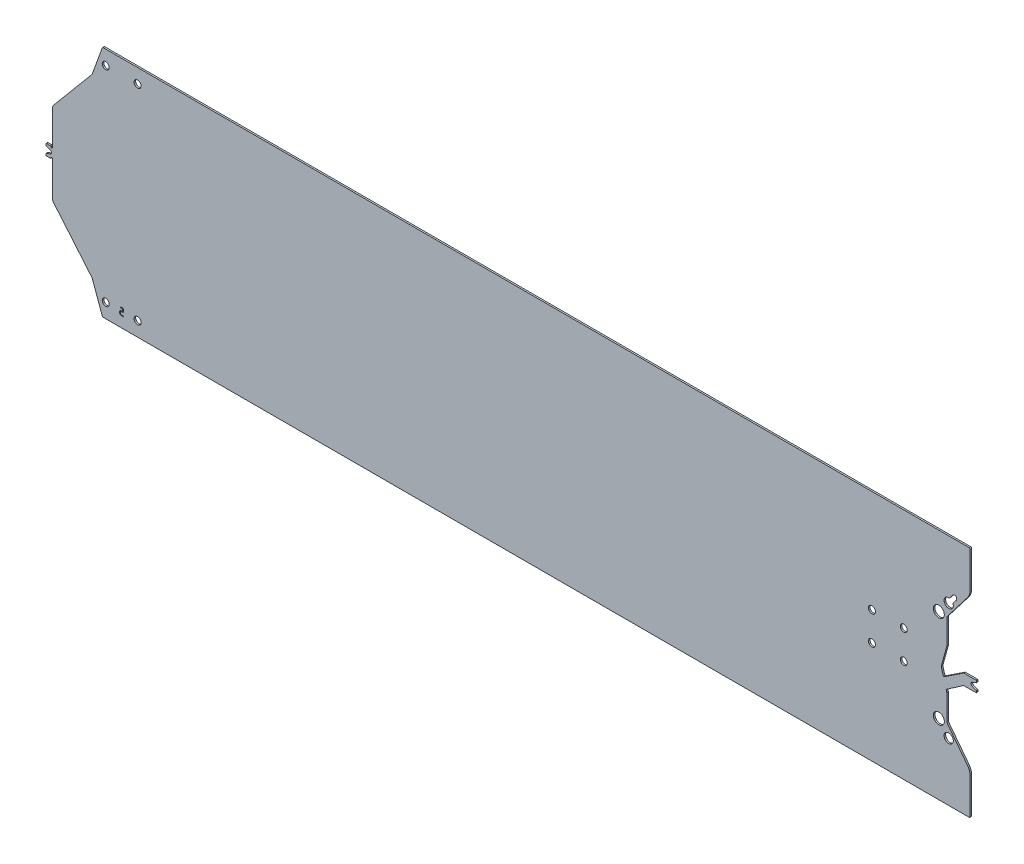
from build123d import *

# Parameters (mm, degrees)
SKETCH1_R                      = 17.25
SKETCH1_R_2                    = 11
SKETCH1_R_3                    = 14.5
BASE_EXTRUDE_DEPTH             = 5
F_5_TAL_DEPTH                  = 2924.07154377
SKETCH2_OUTSIDE_W              = 3524.12
SKETCH2_OUTSIDE_H              = 1337.12
BORTSK_RING_AF_BUKKESTOP_DEPTH = 5
FARINA_BUKKESTOPS_DEPTH        = 5


with BuildPart() as part:
    # Sketch1 → Base-Extrude (new body)
    with BuildSketch(Plane.XY):
        with BuildLine():
            Line((0, 363.5), (0, 252.078170355))
            ThreePointArc((0, 252.078170355), (-2.12279482, 239.220591742), (-8.265866388, 227.727713194))
            Line((-8.265866388, 227.727713194), (-70.933533403, 146.057619484))
            ThreePointArc((-70.933533403, 146.057619484), (-72.469301295, 143.184399847), (-73, 139.970005194))
            Line((-73, 139.970005194), (-73, 63))
            Line((-73, 63), (-89.730328668, 2.672383761))
            ThreePointArc((-89.730328668, 2.672383761), (-90.00268311, 1.348509303), (-90.094024136, 0))
            Line((-90.094024136, 0), (17, 0))
            ThreePointArc((17, 0), (19.121320344, -0.878679656), (20, -3))
            Line((20, -3), (20, -17.437757944))
            ThreePointArc((20, -17.437757944), (19.281217897, -19.386102089), (17.469303395, -20.400822965))
            Line((17.469303395, -20.400822965), (-80.510157999, -35.919245122))
            Line((-80.510157999, -35.919245122), (-73, -63))
            Line((-73, -63), (-73, -139.970005194))
            ThreePointArc((-73, -139.970005194), (-72.469301295, -143.184399847), (-70.933533403, -146.057619484))
            Line((-70.933533403, -146.057619484), (-8.265866388, -227.727713194))
            ThreePointArc((-8.265866388, -227.727713194), (-2.12279482, -239.220591742), (0, -252.078170355))
            Line((0, -252.078170355), (0, -363.5))
            ThreePointArc((0, -363.5), (-0.878679656, -365.621320344), (-3, -366.5))
            Line((-3, -366.5), (-2720.535761072, -366.5))
            ThreePointArc((-2720.535761072, -366.5), (-2722.256490381, -365.957456133), (-2723.354838934, -364.52606043))
            Line((-2723.354838934, -364.52606043), (-2754.790630978, -278.156931626))
            ThreePointArc((-2754.790630978, -278.156931626), (-2755.527303148, -276.577133059), (-2756.527112755, -275.149256963))
            Line((-2756.527112755, -275.149256963), (-2875.320888862, -133.576347508))
            ThreePointArc((-2875.320888862, -133.576347508), (-2878.793852416, -127.560998181), (-2880, -120.720595315))
            Line((-2880, -120.720595315), (-2880, -22.342329219))
            ThreePointArc((-2880, -22.342329219), (-2880.635383686, -20.496092591), (-2882.272393125, -19.431901719))
            Line((-2882.272393125, -19.431901719), (-2897.727606875, -15.568098281))
            ThreePointArc((-2897.727606875, -15.568098281), (-2899.364616314, -14.503907409), (-2900, -12.657670781))
            Line((-2900, -12.657670781), (-2900, -3))
            ThreePointArc((-2900, -3), (-2899.121320344, -0.878679656), (-2897, 0))
            Line((-2897, 0), (-2892.062257748, 0))
            ThreePointArc((-2892.062257748, 0), (-2889.427026365, -0.750817072), (-2887.583225666, -2.777777778))
            ThreePointArc((-2887.583225666, -2.777777778), (-2883.087011135, -4.894412835), (-2880, -1))
            Line((-2880, -1), (-2880, 0))
            Line((-2880, 0), (-2880, 120.720595315))
            ThreePointArc((-2880, 120.720595315), (-2878.793852416, 127.560998181), (-2875.320888862, 133.576347508))
            Line((-2875.320888862, 133.576347508), (-2756.527112755, 275.149256963))
            ThreePointArc((-2756.527112755, 275.149256963), (-2755.527303148, 276.577133059), (-2754.790630978, 278.156931626))
            Line((-2754.790630978, 278.156931626), (-2723.354838934, 364.52606043))
            ThreePointArc((-2723.354838934, 364.52606043), (-2722.256490381, 365.957456133), (-2720.535761072, 366.5))
            Line((-2720.535761072, 366.5), (-3, 366.5))
            ThreePointArc((-3, 366.5), (-0.878679656, 365.621320344), (0, 363.5))
        make_face()
        with Locations((-98, 145.25)):
            Circle(SKETCH1_R, mode=Mode.SUBTRACT)
        with Locations((-2712.5, 321.5)):
            Circle(SKETCH1_R_2, mode=Mode.SUBTRACT)
        with Locations((-2612.5, 321.5)):
            Circle(SKETCH1_R_2, mode=Mode.SUBTRACT)
        with Locations(Location((-2612.5, -321.5, 0), (0, 0, 180))):
            Circle(SKETCH1_R_2, mode=Mode.SUBTRACT)
        with Locations(Location((-2712.5, -321.5, 0), (0, 0, 180))):
            Circle(SKETCH1_R_2, mode=Mode.SUBTRACT)
        with Locations(Location((-98, -145.25, 0), (0, 0, 180))):
            Circle(SKETCH1_R, mode=Mode.SUBTRACT)
        with Locations(Location((-67, -183.75, 0), (0, 0, 180))):
            Circle(SKETCH1_R_3, mode=Mode.SUBTRACT)
        with Locations((-308, 45)):
            Circle(SKETCH1_R_2, mode=Mode.SUBTRACT)
        with Locations((-208, 45)):
            Circle(SKETCH1_R_2, mode=Mode.SUBTRACT)
        with Locations(Location((-308, -45, 0), (0, 0, 180))):
            Circle(SKETCH1_R_2, mode=Mode.SUBTRACT)
        with Locations(Location((-208, -45, 0), (0, 0, 180))):
            Circle(SKETCH1_R_2, mode=Mode.SUBTRACT)
        with BuildLine():
            Line((-43.183683748, 203.289270206), (-52.703856204, 190.882339907))
            ThreePointArc((-52.703856204, 190.882339907), (-53.278899256, 189.573129916), (-53.18257398, 188.146446085))
            ThreePointArc((-53.18257398, 188.146446085), (-75.827040721, 172.246376566), (-66.329572191, 198.234492623))
            ThreePointArc((-66.329572191, 198.234492623), (-64.926570616, 198.510702498), (-63.810802968, 199.404999913))
            Line((-63.810802968, 199.404999913), (-54.290630512, 211.811930212))
            ThreePointArc((-54.290630512, 211.811930212), (-44.475827127, 213.104073591), (-43.183683748, 203.289270206))
        make_face(mode=Mode.SUBTRACT)
    extrude(amount=BASE_EXTRUDE_DEPTH)

    # Sketch5 → 5 tal (cut, through all)
    with BuildSketch(Plane.XY.offset(5)):
        with BuildLine():
            Line((-2665.75, -313), (-2660.25, -313))
            ThreePointArc((-2660.25, -313), (-2659.542893219, -313.292893219), (-2659.25, -314))
            Line((-2659.25, -314), (-2659.25, -319))
            ThreePointArc((-2659.25, -319), (-2659.542893219, -319.707106781), (-2660.25, -320))
            Line((-2660.25, -320), (-2662.5, -320))
            ThreePointArc((-2662.5, -320), (-2669.25, -326.75), (-2662.5, -333.5))
            Line((-2662.5, -333.5), (-2657.75, -333.5))
            ThreePointArc((-2657.75, -333.5), (-2657.042893219, -333.207106781), (-2656.75, -332.5))
            Line((-2656.75, -332.5), (-2656.75, -332))
            ThreePointArc((-2656.75, -332), (-2657.042893219, -331.292893219), (-2657.75, -331))
            Line((-2657.75, -331), (-2662.5, -331))
            ThreePointArc((-2662.5, -331), (-2666.75, -326.75), (-2662.5, -322.5))
            Line((-2662.5, -322.5), (-2660.25, -322.5))
            ThreePointArc((-2660.25, -322.5), (-2657.775126266, -321.474873734), (-2656.75, -319))
            Line((-2656.75, -319), (-2656.75, -314))
            ThreePointArc((-2656.75, -314), (-2657.775126266, -311.525126266), (-2660.25, -310.5))
            Line((-2660.25, -310.5), (-2665.75, -310.5))
            ThreePointArc((-2665.75, -310.5), (-2666.457106781, -310.792893219), (-2666.75, -311.5))
            Line((-2666.75, -311.5), (-2666.75, -312))
            ThreePointArc((-2666.75, -312), (-2666.457106781, -312.707106781), (-2665.75, -313))
        make_face()
    extrude(amount=-F_5_TAL_DEPTH, mode=Mode.SUBTRACT)

    # Sketch2 outside → Bortskæring af bukkestop (cut)
    with BuildSketch(Plane.XY.offset(5)):
        with Locations((-1440, 0)):
            Rectangle(SKETCH2_OUTSIDE_W, SKETCH2_OUTSIDE_H)
        with BuildLine():
            Line((0, -524.643652554), (-2880, -524.643652554))
            Line((-2880, -524.643652554), (-2880, 479.359658705))
            Line((-2880, 479.359658705), (0, 479.359658705))
            Line((0, 479.359658705), (0, 139.970005194))
            Line((0, 139.970005194), (-73, 139.970005194))
            Line((-73, 139.970005194), (-73, 63))
            Line((-73, 63), (-89.730328668, 2.672383761))
            ThreePointArc((-89.730328668, 2.672383761), (-90.094024136, 0), (-89.730328668, -2.672383761))
            Line((-89.730328668, -2.672383761), (-73, -63))
            Line((-73, -63), (-73, -139.970005194))
            Line((-73, -139.970005194), (0, -139.970005194))
            Line((0, -139.970005194), (0, -524.643652554))
        make_face(mode=Mode.SUBTRACT)
    extrude(amount=-BORTSK_RING_AF_BUKKESTOP_DEPTH, mode=Mode.SUBTRACT)

    # Sketch6 → Farina bukkestops (add)
    with BuildSketch(Plane.XY.offset(5)):
        with BuildLine():
            Line((-2886.94787914, 5.638155725), (-2899.342020143, 10.149254129))
            ThreePointArc((-2899.342020143, 10.149254129), (-2899.819152044, 10.515370314), (-2900, 11.08894675))
            Line((-2900, 11.08894675), (-2900, 16))
            ThreePointArc((-2900, 16), (-2899.707106781, 16.707106781), (-2899, 17))
            Line((-2899, 17), (-2886, 17))
            ThreePointArc((-2886, 17), (-2884.585786438, 16.414213562), (-2884, 15))
            Line((-2884, 15), (-2884, 14.5))
            ThreePointArc((-2884, 14.5), (-2882, 12.5), (-2880, 14.5))
            Line((-2880, 14.5), (-2880, -14.5))
            ThreePointArc((-2880, -14.5), (-2882, -12.5), (-2884, -14.5))
            Line((-2884, -14.5), (-2884, -15))
            ThreePointArc((-2884, -15), (-2884.585786438, -16.414213562), (-2886, -17))
            Line((-2886, -17), (-2899, -17))
            ThreePointArc((-2899, -17), (-2899.707106781, -16.707106781), (-2900, -16))
            Line((-2900, -16), (-2900, -11.08894675))
            ThreePointArc((-2900, -11.08894675), (-2899.819152044, -10.515370314), (-2899.342020143, -10.149254129))
            Line((-2899.342020143, -10.149254129), (-2886.94787914, -5.638155725))
            ThreePointArc((-2886.94787914, -5.638155725), (-2883, 0), (-2886.94787914, 5.638155725))
        make_face()
        with BuildLine():
            Line((6.94787914, 5.638155725), (19.342020143, 10.149254129))
            ThreePointArc((19.342020143, 10.149254129), (19.819152044, 10.515370314), (20, 11.08894675))
            Line((20, 11.08894675), (20, 16))
            ThreePointArc((20, 16), (19.707106781, 16.707106781), (19, 17))
            Line((19, 17), (-19.098089332, 17))
            ThreePointArc((-19.098089332, 17), (-19.961811527, 16.87297476), (-20.752390709, 16.502655981))
            Line((-20.752390709, 16.502655981), (-83.538332674, -25))
            Line((-83.538332674, -25), (-75.218596352, -55))
            Line((-75.218596352, -55), (-20.768195378, -17.528652053))
            ThreePointArc((-20.768195378, -17.528652053), (-19.957971247, -17.135209969), (-19.06747808, -17))
            Line((-19.06747808, -17), (19, -17))
            ThreePointArc((19, -17), (19.707106781, -16.707106781), (20, -16))
            Line((20, -16), (20, -11.08894675))
            ThreePointArc((20, -11.08894675), (19.819152044, -10.515370314), (19.342020143, -10.149254129))
            Line((19.342020143, -10.149254129), (6.94787914, -5.638155725))
            ThreePointArc((6.94787914, -5.638155725), (3, 0), (6.94787914, 5.638155725))
        make_face()
    extrude(amount=-FARINA_BUKKESTOPS_DEPTH)


solid = part.part
